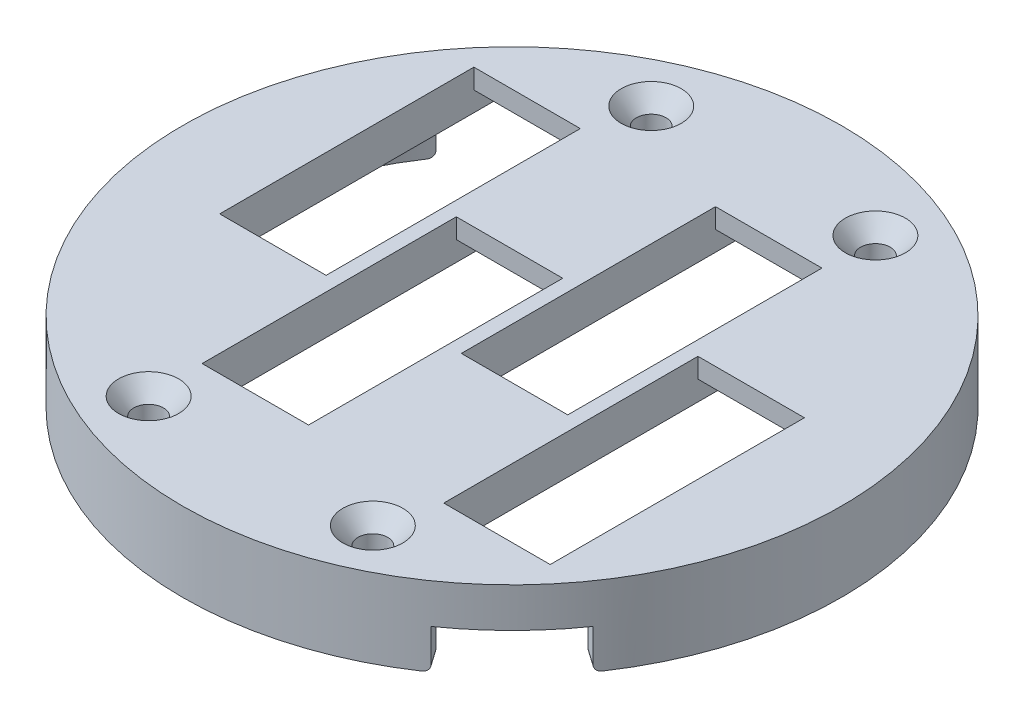
from build123d import *

# Parameters (mm, degrees)
A_BASE_T_START                                    = -1.5
A_BASE_T_OUTLINE_R                                = 47
A_BASE_T_OUTLINE_R_2                              = 1
A_BASE_T_DEPTH                                    = 3
SKETCH2_W                                         = 16.15
SKETCH2_H                                         = 38.570021247
FINGER_BASE_THROUGH_HOLES_DEPTH                   = 67.535704701
RING_START                                        = 3
SKETCH3_R                                         = 4
SKETCH3_R_2                                       = 1
RING_EXTRUDE_DEPTH                                = 3
OUTER_RING_DEPTH                                  = 9
OUTER_RING_DEPTH_BACK                             = 3
SKETCH1_R                                         = 50
SKETCH1_R_2                                       = 47
FRAME_EXTRUDE_1_DEPTH                             = 3
FRAME_START                                       = 3
SKETCH5_W                                         = 16.15
SKETCH5_H                                         = 3
SKETCH5_W_2                                       = 16.149999998
FRAME_EXTRUDE_2_DEPTH                             = 3
CSK_FOR_8_FLAT_HEAD_SOCKET_CAP_SCREW1_D           = 4.4958
CSK_FOR_8_FLAT_HEAD_SOCKET_CAP_SCREW1_CSINK_D     = 9.1186
CSK_FOR_8_FLAT_HEAD_SOCKET_CAP_SCREW1_CSINK_ANGLE = 82
ALLOWANCE_CUT_1_REACH                             = 72.965
ALLOWANCE_CUT_1_DIRECTION_2_REACH                 = 72.965
ALLOWANCE_CUT_2_DEPTH                             = 6
CONTOURING_START                                  = -4.5
CONTOURING_DEPTH                                  = 3.5
CONTOURING_START_2                                = -51
CONTOURING_2_DEPTH                                = 102
CONTOURING_3_DEPTH                                = 102


with BuildPart() as part:
    # a_base_t: read off the stored shape, not the designer's step
    # a_base_t outline → a_base_t (new body)
    with BuildSketch(Plane(origin=(0, 0, 0), x_dir=(1, 0, 0), z_dir=(0, 1, 0)).offset(A_BASE_T_START)):
        Circle(A_BASE_T_OUTLINE_R)
        with Locations((-17.009259258, -38.128042167)):
            Circle(A_BASE_T_OUTLINE_R_2, mode=Mode.SUBTRACT)
        with Locations((-9.166666665, -28.284271247)):
            Circle(A_BASE_T_OUTLINE_R_2, mode=Mode.SUBTRACT)
        with Locations((17.009259258, -38.128042167)):
            Circle(A_BASE_T_OUTLINE_R_2, mode=Mode.SUBTRACT)
        with Locations((27.5, -28.284271247)):
            Circle(A_BASE_T_OUTLINE_R_2, mode=Mode.SUBTRACT)
        with Locations((-27.5, 28.284271247)):
            Circle(A_BASE_T_OUTLINE_R_2, mode=Mode.SUBTRACT)
        with Locations((-17.009259258, 38.128042167)):
            Circle(A_BASE_T_OUTLINE_R_2, mode=Mode.SUBTRACT)
        with Locations((9.166666665, 28.284271247)):
            Circle(A_BASE_T_OUTLINE_R_2, mode=Mode.SUBTRACT)
        with Locations((17.009259258, 38.128042167)):
            Circle(A_BASE_T_OUTLINE_R_2, mode=Mode.SUBTRACT)
    extrude(amount=A_BASE_T_DEPTH)

    # Sketch2 → Finger Base Through Holes (cut, through all)
    with BuildSketch(Plane.XZ.offset(1.5)):
        with Locations((27.499999997, 10.499260624)):
            Rectangle(SKETCH2_W, SKETCH2_H)
        with Locations((9.166666665, -10.499260624)):
            Rectangle(SKETCH2_W, SKETCH2_H)
        with Locations((-9.166666667, 10.499260624)):
            Rectangle(SKETCH2_W, SKETCH2_H)
        with Locations((-27.5, -10.499260624)):
            Rectangle(SKETCH2_W, SKETCH2_H)
    extrude(amount=-FINGER_BASE_THROUGH_HOLES_DEPTH, mode=Mode.SUBTRACT)

    # Sketch3 → Ring Extrude (add)
    # profile 1 of 4: a face of its own
    with BuildSketch(Plane.XZ.offset(1.5).offset(RING_START)):
        with Locations(Location((17.009259258, 38.128042167, 0), (0, 0, 90))):
            Circle(SKETCH3_R)
        with Locations(Location((17.009259258, 38.128042167, 0), (0, 0, 90))):
            Circle(SKETCH3_R_2, mode=Mode.SUBTRACT)
    # profile 2 of 4: a face of its own
    with BuildSketch(Plane.XZ.offset(1.5).offset(RING_START)):
        with Locations(Location((17.009259258, -38.128042167, 0), (0, 0, 90))):
            Circle(SKETCH3_R)
        with Locations(Location((17.009259258, -38.128042167, 0), (0, 0, 270))):
            Circle(SKETCH3_R_2, mode=Mode.SUBTRACT)
    # profile 3 of 4: a face of its own
    with BuildSketch(Plane.XZ.offset(1.5).offset(RING_START)):
        with Locations(Location((-17.009259258, -38.128042167, 0), (0, 0, 90))):
            Circle(SKETCH3_R)
        with Locations(Location((-17.009259258, -38.128042167, 0), (0, 0, 90))):
            Circle(SKETCH3_R_2, mode=Mode.SUBTRACT)
    # profile 4 of 4: a face of its own
    with BuildSketch(Plane.XZ.offset(1.5).offset(RING_START)):
        with Locations(Location((-17.009259258, 38.128042167, 0), (0, 0, 90))):
            Circle(SKETCH3_R)
        with Locations(Location((-17.009259258, 38.128042167, 0), (0, 0, 270))):
            Circle(SKETCH3_R_2, mode=Mode.SUBTRACT)
    extrude(amount=-RING_EXTRUDE_DEPTH)

    # Sketch1 → Outer Ring (add, two sides: drawn at the far end of the back side and taken through both)
    with BuildSketch(Plane.XZ.offset(1.5).offset(-OUTER_RING_DEPTH_BACK)):
        with Locations(Location((0, 0, 0), (0, 0, 90))):
            Circle(SKETCH1_R)
        with Locations(Location((0, 0, 0), (0, 0, 90))):
            Circle(SKETCH1_R_2, mode=Mode.SUBTRACT)
    extrude(amount=OUTER_RING_DEPTH + OUTER_RING_DEPTH_BACK)

    # Sketch4 → Frame Extrude 1 (add)
    with BuildSketch(Plane.XZ.offset(1.5)):
        with BuildLine():
            Line((17.241666665, 34.134799525), (17.241666665, -34.134799525))
            ThreePointArc((17.241666665, -34.134799525), (18.393174805, -34.375072974), (19.424999997, -34.939908437))
            Line((19.424999997, -34.939908437), (19.424999997, 34.939908437))
            ThreePointArc((19.424999997, 34.939908437), (18.393174805, 34.375072974), (17.241666665, 34.134799525))
        make_face()
        with BuildLine():
            Line((1.091666665, 46.987320246), (1.091666665, -46.987320246))
            ThreePointArc((1.091666665, -46.987320246), (-1e-09, -47), (-1.091666667, -46.987320246))
            Line((-1.091666667, -46.987320246), (-1.091666667, 46.987320246))
            ThreePointArc((-1.091666667, 46.987320246), (-1e-09, 47), (1.091666665, 46.987320246))
        make_face()
        with BuildLine():
            Line((35.574999997, 30.715132674), (35.574999997, -30.715132674))
            ThreePointArc((35.574999997, -30.715132674), (37.125311456, -28.82206185), (38.574999997, -26.850872894))
            Line((38.574999997, -26.850872894), (38.574999997, 26.850872894))
            ThreePointArc((38.574999997, 26.850872894), (37.125311456, 28.82206185), (35.574999997, 30.715132674))
        make_face()
        with BuildLine():
            Line((-38.574999997, 26.850872894), (-38.574999997, -26.850872894))
            ThreePointArc((-38.574999997, -26.850872894), (-37.125311456, -28.82206185), (-35.574999997, -30.715132674))
            Line((-35.574999997, -30.715132674), (-35.574999997, 30.715132674))
            ThreePointArc((-35.574999997, 30.715132674), (-37.125311456, 28.82206185), (-38.574999997, 26.850872894))
        make_face()
        with BuildLine():
            Line((-19.424999997, -34.939908437), (-19.424999997, 34.939908437))
            ThreePointArc((-19.424999997, 34.939908437), (-18.393174805, 34.375072974), (-17.241666665, 34.134799525))
            Line((-17.241666665, 34.134799525), (-17.241666665, -34.134799525))
            ThreePointArc((-17.241666665, -34.134799525), (-18.393174805, -34.375072974), (-19.424999997, -34.939908437))
        make_face()
        with BuildLine():
            Line((19.424999997, 41.316175897), (19.424999997, 42.798006672))
            ThreePointArc((19.424999997, 42.798006672), (18.339169616, 43.274413431), (17.241666665, 43.72327676))
            Line((17.241666665, 43.72327676), (17.241666665, 42.121284809))
            ThreePointArc((17.241666665, 42.121284809), (18.393174805, 41.881011359), (19.424999997, 41.316175897))
        make_face()
        with BuildLine():
            Line((19.424999997, -41.316175897), (19.424999997, -42.798006672))
            ThreePointArc((19.424999997, -42.798006672), (18.339169616, -43.274413431), (17.241666665, -43.72327676))
            Line((17.241666665, -43.72327676), (17.241666665, -42.121284809))
            ThreePointArc((17.241666665, -42.121284809), (18.393174805, -41.881011359), (19.424999997, -41.316175897))
        make_face()
        with BuildLine():
            Line((-17.241666665, -42.121284809), (-17.241666665, -43.72327676))
            ThreePointArc((-17.241666665, -43.72327676), (-18.339169616, -43.274413431), (-19.424999997, -42.798006672))
            Line((-19.424999997, -42.798006672), (-19.424999997, -41.316175897))
            ThreePointArc((-19.424999997, -41.316175897), (-18.393174805, -41.881011359), (-17.241666665, -42.121284809))
        make_face()
        with BuildLine():
            Line((-17.241666665, 42.121284809), (-17.241666665, 43.72327676))
            ThreePointArc((-17.241666665, 43.72327676), (-18.339169616, 43.274413431), (-19.424999997, 42.798006672))
            Line((-19.424999997, 42.798006672), (-19.424999997, 41.316175897))
            ThreePointArc((-19.424999997, 41.316175897), (-18.393174805, 41.881011359), (-17.241666665, 42.121284809))
        make_face()
    extrude(amount=FRAME_EXTRUDE_1_DEPTH)

    # Sketch5 → Frame Extrude 2 (add)
    with BuildSketch(Plane.XZ.offset(1.5).offset(FRAME_START)):
        with Locations((27.499999997, -14.28575)):
            Rectangle(SKETCH5_W, SKETCH5_H)
        with Locations((9.166666665, 14.28575)):
            Rectangle(SKETCH5_W, SKETCH5_H)
        with Locations((-9.166666666, -14.28575)):
            Rectangle(SKETCH5_W_2, SKETCH5_H)
        with Locations((-27.499999997, 14.28575)):
            Rectangle(SKETCH5_W, SKETCH5_H)
        with BuildLine():
            Line((17.241666665, -33.784271247), (1.091666665, -33.784271247))
            Line((1.091666665, -33.784271247), (1.091666665, -36.784271247))
            Line((1.091666665, -36.784271247), (13.241729602, -36.784271247))
            ThreePointArc((13.241729602, -36.784271247), (14.800368715, -34.793255432), (17.241666665, -34.134799525))
            Line((17.241666665, -34.134799525), (17.241666665, -33.784271247))
        make_face()
        with BuildLine():
            Line((-19.424999997, -33.784271247), (-32.67450101, -33.784271247))
            ThreePointArc((-32.67450101, -33.784271247), (-26.436742573, -38.859987675), (-19.424999997, -42.798006672))
            Line((-19.424999997, -42.798006672), (-19.424999997, -41.316175897))
            ThreePointArc((-19.424999997, -41.316175897), (-21.009259258, -38.128042167), (-19.424999997, -34.939908437))
            Line((-19.424999997, -34.939908437), (-19.424999997, -33.784271247))
        make_face()
        with BuildLine():
            Line((-1.091666667, 33.784271247), (-17.241666665, 33.784271247))
            Line((-17.241666665, 33.784271247), (-17.241666665, 34.134799525))
            ThreePointArc((-17.241666665, 34.134799525), (-14.800368715, 34.793255432), (-13.241729602, 36.784271247))
            Line((-13.241729602, 36.784271247), (-1.091666667, 36.784271247))
            Line((-1.091666667, 36.784271247), (-1.091666667, 33.784271247))
        make_face()
        with BuildLine():
            Line((19.424999997, 33.784271247), (19.424999997, 34.939908437))
            ThreePointArc((19.424999997, 34.939908437), (21.009259258, 38.128042167), (19.424999997, 41.316175897))
            Line((19.424999997, 41.316175897), (19.424999997, 42.798006672))
            ThreePointArc((19.424999997, 42.798006672), (26.436742573, 38.859987675), (32.67450101, 33.784271247))
            Line((32.67450101, 33.784271247), (19.424999997, 33.784271247))
        make_face()
    extrude(amount=-FRAME_EXTRUDE_2_DEPTH)

    # CSK for #8 Flat Head Socket Cap Screw1 (through all)
    with Locations(Plane(origin=(0, 1.5, 0), x_dir=(1, 0, 0), z_dir=(0, 1, 0))):
        with Locations((-17.009259258, -38.128042167), (-17.009259258, 38.128042167), (17.009259258, 38.128042167), (17.009259258, -38.128042167)):
            CounterSinkHole(CSK_FOR_8_FLAT_HEAD_SOCKET_CAP_SCREW1_D / 2, CSK_FOR_8_FLAT_HEAD_SOCKET_CAP_SCREW1_CSINK_D / 2, counter_sink_angle=CSK_FOR_8_FLAT_HEAD_SOCKET_CAP_SCREW1_CSINK_ANGLE)

    # Allowance Cut 1: up to this face of the body (flat: up to its plane)
    allowance_cut_1_end = Plane(part.part.faces().sort_by_distance((26.989874737, -1.5, 31.713197402))[0])
    # Sketch10 → Allowance Cut 1 (cut, up to the picked face)
    with BuildSketch(Plane.XZ.offset(4.5), mode=Mode.PRIVATE) as allowance_cut_1_sk1:
        Polygon((32.67450101, 33.784271247), (35.574999997, 33.784271247), (35.574999997, 30.715132674), align=None)
    allowance_cut_1_tool1 = split(extrude(allowance_cut_1_sk1.sketch, amount=-ALLOWANCE_CUT_1_REACH, mode=Mode.PRIVATE), bisect_by=allowance_cut_1_end, keep=Keep.BOTH, mode=Mode.PRIVATE)
    # Sketch10 → Allowance Cut 1 (cut, up to the picked face)
    with BuildSketch(Plane.XZ.offset(4.5), mode=Mode.PRIVATE) as allowance_cut_1_sk2:
        Polygon((-35.574999997, -30.715132674), (-35.574999997, -33.784271247), (-32.67450101, -33.784271247), align=None)
    allowance_cut_1_tool2 = split(extrude(allowance_cut_1_sk2.sketch, amount=-ALLOWANCE_CUT_1_REACH, mode=Mode.PRIVATE), bisect_by=allowance_cut_1_end, keep=Keep.BOTH, mode=Mode.PRIVATE)
    add(allowance_cut_1_tool1.solids().sort_by(Axis((34.608167, -4.5, 32.761225), (0, 1, 0)))[0], mode=Mode.SUBTRACT)
    add(allowance_cut_1_tool2.solids().sort_by(Axis((-34.608167, -4.5, -32.761225), (0, 1, 0)))[0], mode=Mode.SUBTRACT)

    # Allowance Cut 1 direction 2: up to this face of the body (flat: up to its plane)
    allowance_cut_1_direction_2_end = Plane(part.part.faces().sort_by_distance((0, -10.5, -48.585786438))[0])
    # Sketch10 → Allowance Cut 1 direction 2 (cut, up to the picked face)
    with BuildSketch(Plane.XZ.offset(4.5), mode=Mode.PRIVATE) as allowance_cut_1_direction_2_sk1:
        Polygon((32.67450101, 33.784271247), (35.574999997, 33.784271247), (35.574999997, 30.715132674), align=None)
    allowance_cut_1_direction_2_tool1 = split(extrude(allowance_cut_1_direction_2_sk1.sketch, amount=ALLOWANCE_CUT_1_DIRECTION_2_REACH, mode=Mode.PRIVATE), bisect_by=allowance_cut_1_direction_2_end, keep=Keep.BOTH, mode=Mode.PRIVATE)
    # Sketch10 → Allowance Cut 1 direction 2 (cut, up to the picked face)
    with BuildSketch(Plane.XZ.offset(4.5), mode=Mode.PRIVATE) as allowance_cut_1_direction_2_sk2:
        Polygon((-35.574999997, -30.715132674), (-35.574999997, -33.784271247), (-32.67450101, -33.784271247), align=None)
    allowance_cut_1_direction_2_tool2 = split(extrude(allowance_cut_1_direction_2_sk2.sketch, amount=ALLOWANCE_CUT_1_DIRECTION_2_REACH, mode=Mode.PRIVATE), bisect_by=allowance_cut_1_direction_2_end, keep=Keep.BOTH, mode=Mode.PRIVATE)
    add(allowance_cut_1_direction_2_tool1.solids().sort_by(Axis((34.608167, -4.5, 32.761225), (0, -1, 0)))[0], mode=Mode.SUBTRACT)
    add(allowance_cut_1_direction_2_tool2.solids().sort_by(Axis((-34.608167, -4.5, -32.761225), (0, -1, 0)))[0], mode=Mode.SUBTRACT)

    # Sketch12 → Allowance Cut 2 (cut)
    with BuildSketch(Plane.XZ.offset(10.5)):
        with BuildLine():
            Line((28.678821818, 40.957602214), (26.958092508, 38.500146082))
            Line((26.958092508, 38.500146082), (38.500146082, 26.958092508))
            Line((38.500146082, 26.958092508), (40.957602214, 28.678821818))
            ThreePointArc((40.957602214, 28.678821818), (35.355339059, 35.355339059), (28.678821818, 40.957602214))
        make_face()
        with BuildLine():
            Line((-26.958092508, -38.500146082), (-28.678821818, -40.957602214))
            ThreePointArc((-28.678821818, -40.957602214), (-35.355339059, -35.355339059), (-40.957602214, -28.678821818))
            Line((-40.957602214, -28.678821818), (-38.500146082, -26.958092508))
            Line((-38.500146082, -26.958092508), (-26.958092508, -38.500146082))
        make_face()
    extrude(amount=-ALLOWANCE_CUT_2_DEPTH, mode=Mode.SUBTRACT)

    # Contouring: read off the stored shape, not the designer's step
    # Contouring outline → Contouring (add)
    with BuildSketch(Plane(origin=(0, 0, 0), x_dir=(1, 0, 0), z_dir=(0, 1, 0)).offset(CONTOURING_START)):
        with BuildLine():
            Line((17.241666665, -15.78575), (16.241666665, -15.78575))
            ThreePointArc((16.241666665, -15.78575), (16.948773446, -16.078643219), (17.241666665, -16.78575))
            Line((17.241666665, -16.78575), (17.241666665, -15.78575))
        make_face()
        with BuildLine():
            ThreePointArc((17.241666665, -43.037289226), (17.064187093, -43.606024793), (16.594746375, -43.97288247))
            ThreePointArc((16.594746375, -43.97288247), (16.918666839, -43.849272655), (17.241666665, -43.72327676))
            Line((17.241666665, -43.72327676), (17.241666665, -43.037289226))
        make_face()
        with BuildLine():
            ThreePointArc((-40.435326085, -23.957971626), (-39.531634502, -25.421445153), (-38.574999998, -26.850872894))
            Line((-38.574999998, -26.850872894), (-38.574999998, -23.448227549))
            ThreePointArc((-38.574999998, -23.448227549), (-39.310733169, -24.412677156), (-40.435326085, -23.957971626))
        make_face()
        with BuildLine():
            Line((-19.424999997, -15.78575), (-20.425, -15.78575))
            ThreePointArc((-20.425, -15.78575), (-19.717893219, -16.078643219), (-19.425, -16.78575))
            Line((-19.425, -16.78575), (-19.424999997, -15.78575))
        make_face()
        with BuildLine():
            Line((-35.575, -15.78575), (-35.575, -16.78575))
            ThreePointArc((-35.575, -16.78575), (-35.282106781, -16.078643219), (-34.575, -15.78575))
            Line((-34.575, -15.78575), (-35.575, -15.78575))
        make_face()
        with BuildLine():
            ThreePointArc((-35.574999999, -30.715132673), (-35.451102296, -30.858051559), (-35.326630435, -31.000470676))
            ThreePointArc((-35.326630435, -31.000470676), (-35.510849997, -30.693284806), (-35.575, -30.340886193))
            Line((-35.575, -30.340886193), (-35.574999999, -30.715132673))
        make_face()
        with BuildLine():
            ThreePointArc((-20.864193833, -42.115144731), (-20.147490166, -42.462673491), (-19.424999997, -42.798006672))
            Line((-19.424999997, -42.798006672), (-19.424999998, -41.316175897))
            ThreePointArc((-19.424999998, -41.316175897), (-19.934902686, -42.093385488), (-20.864193833, -42.115144731))
        make_face()
        with BuildLine():
            ThreePointArc((-17.241666665, -43.72327676), (-16.918666839, -43.849272655), (-16.594746375, -43.97288247))
            ThreePointArc((-16.594746375, -43.97288247), (-17.064187093, -43.606024793), (-17.241666665, -43.037289226))
            Line((-17.241666665, -43.037289226), (-17.241666665, -43.72327676))
        make_face()
        with BuildLine():
            ThreePointArc((-2.091666667, -36.784271247), (-1.384559886, -37.077164466), (-1.091666667, -37.784271247))
            Line((-1.091666667, -37.784271247), (-1.091666667, -36.784271247))
            Line((-1.091666667, -36.784271247), (-2.091666667, -36.784271247))
        make_face()
        with BuildLine():
            ThreePointArc((-2.137137682, -46.951385949), (-1.614502152, -46.972261845), (-1.091666667, -46.987320246))
            Line((-1.091666667, -46.987320246), (-1.091666667, -45.95242029))
            ThreePointArc((-1.091666667, -45.95242029), (-1.400823347, -46.67542479), (-2.137137682, -46.951385949))
        make_face()
        with BuildLine():
            ThreePointArc((2.137137679, -46.951385949), (1.400823345, -46.675424791), (1.091666665, -45.952420291))
            Line((1.091666665, -45.952420291), (1.091666665, -46.987320246))
            ThreePointArc((1.091666665, -46.987320246), (1.61450215, -46.972261845), (2.137137679, -46.951385949))
        make_face()
        with BuildLine():
            ThreePointArc((1.091666665, -16.78575), (1.384559884, -16.078643219), (2.091666665, -15.78575))
            Line((2.091666665, -15.78575), (1.091666665, -15.78575))
            Line((1.091666665, -15.78575), (1.091666665, -16.78575))
        make_face()
        with BuildLine():
            ThreePointArc((-38.574999998, 26.850872894), (-39.531634502, 25.421445153), (-40.435326085, 23.957971627))
            ThreePointArc((-40.435326085, 23.957971627), (-39.310733169, 24.412677156), (-38.574999998, 23.448227549))
            Line((-38.574999998, 23.448227549), (-38.574999998, 26.850872894))
        make_face()
        with BuildLine():
            Line((19.424999997, 15.78575), (20.424999997, 15.78575))
            ThreePointArc((20.424999997, 15.78575), (19.717893216, 16.078643219), (19.424999997, 16.78575))
            Line((19.424999997, 16.78575), (19.424999997, 15.78575))
        make_face()
        with BuildLine():
            Line((35.574999997, 15.78575), (35.574999997, 16.78575))
            ThreePointArc((35.574999997, 16.78575), (35.282106779, 16.078643218), (34.574999997, 15.78575))
            Line((34.574999997, 15.78575), (35.574999997, 15.78575))
        make_face()
        with BuildLine():
            ThreePointArc((2.091666665, 36.784271247), (1.384559884, 37.077164466), (1.091666665, 37.784271247))
            Line((1.091666665, 37.784271247), (1.091666665, 36.784271247))
            Line((1.091666665, 36.784271247), (2.091666665, 36.784271247))
        make_face()
        with BuildLine():
            Line((-17.241666665, 15.78575), (-16.241666667, 15.78575))
            ThreePointArc((-16.241666667, 15.78575), (-16.948773449, 16.078643219), (-17.241666667, 16.78575))
            Line((-17.241666667, 16.78575), (-17.241666665, 15.78575))
        make_face()
        with BuildLine():
            Line((-1.091666667, 15.78575), (-1.091666667, 16.78575))
            ThreePointArc((-1.091666667, 16.78575), (-1.384559886, 16.078643219), (-2.091666667, 15.78575))
            Line((-2.091666667, 15.78575), (-1.091666667, 15.78575))
        make_face()
        with BuildLine():
            ThreePointArc((-17.241666665, 43.037289226), (-17.064187093, 43.606024793), (-16.594746375, 43.97288247))
            ThreePointArc((-16.594746375, 43.97288247), (-16.918666839, 43.849272655), (-17.241666665, 43.72327676))
            Line((-17.241666665, 43.72327676), (-17.241666665, 43.037289226))
        make_face()
        with BuildLine():
            Line((-1.091666667, 45.95242029), (-1.091666667, 46.987320246))
            ThreePointArc((-1.091666667, 46.987320246), (-1.614502152, 46.972261845), (-2.137137682, 46.951385949))
            ThreePointArc((-2.137137682, 46.951385949), (-1.400823347, 46.67542479), (-1.091666667, 45.95242029))
        make_face()
        with BuildLine():
            ThreePointArc((1.091666665, 45.952420291), (1.400823345, 46.675424791), (2.137137679, 46.951385949))
            ThreePointArc((2.137137679, 46.951385949), (1.61450215, 46.972261845), (1.091666665, 46.987320246))
            Line((1.091666665, 46.987320246), (1.091666665, 45.952420291))
        make_face()
        with BuildLine():
            Line((17.241666665, 43.037289226), (17.241666665, 43.72327676))
            ThreePointArc((17.241666665, 43.72327676), (16.918666839, 43.849272655), (16.594746375, 43.97288247))
            ThreePointArc((16.594746375, 43.97288247), (17.064187093, 43.606024793), (17.241666665, 43.037289226))
        make_face()
        with BuildLine():
            ThreePointArc((19.424999997, 41.316175897), (19.934902686, 42.093385488), (20.864193833, 42.115144731))
            ThreePointArc((20.864193833, 42.115144731), (20.147490166, 42.462673491), (19.424999997, 42.798006672))
            Line((19.424999997, 42.798006672), (19.424999997, 41.316175897))
        make_face()
        with BuildLine():
            Line((35.574999998, 30.340886196), (35.574999998, 30.715132674))
            ThreePointArc((35.574999998, 30.715132674), (35.451102294, 30.858051562), (35.326630432, 31.000470679))
            ThreePointArc((35.326630432, 31.000470679), (35.510849995, 30.69328481), (35.574999998, 30.340886196))
        make_face()
        with BuildLine():
            ThreePointArc((40.435326084, -23.957971626), (39.310733169, -24.412677156), (38.574999998, -23.448227549))
            Line((38.574999998, -23.448227549), (38.574999998, -26.850872894))
            ThreePointArc((38.574999998, -26.850872894), (39.531634502, -25.421445153), (40.435326084, -23.957971626))
        make_face()
        with BuildLine():
            Line((38.574999998, 26.850872894), (38.574999998, 23.448227549))
            ThreePointArc((38.574999998, 23.448227549), (39.310733169, 24.412677156), (40.435326084, 23.957971626))
            ThreePointArc((40.435326084, 23.957971626), (39.531634502, 25.421445153), (38.574999998, 26.850872894))
        make_face()
    extrude(amount=CONTOURING_DEPTH)

    # Contouring 2 outline → Contouring 2 (cut)
    with BuildSketch(Plane(origin=(0, 0, 0), x_dir=(0.5735764363510298, 0, -0.8191520442890032), z_dir=(0.8191520442890031, 0, 0.5735764363510301)).offset(CONTOURING_START_2)):
        with BuildLine():
            ThreePointArc((1, -10.5), (0.292893219, -10.207106781), (0, -9.5))
            ThreePointArc((0, -9.5), (-0.292893219, -10.207106781), (-1, -10.5))
            Line((-1, -10.5), (1, -10.5))
        make_face()
    extrude(amount=CONTOURING_2_DEPTH, mode=Mode.SUBTRACT)

    # Contouring 3 outline → Contouring 3 (cut)
    with BuildSketch(Plane(origin=(0, 0, 0), x_dir=(0.8191520442889688, 0, -0.5735764363510789), z_dir=(0.5735764363510789, 0, 0.8191520442889688)).offset(CONTOURING_START_2)):
        with BuildLine():
            ThreePointArc((0, -9.5), (-0.292893219, -10.207106781), (-1, -10.5))
            Line((-1, -10.5), (1, -10.5))
            ThreePointArc((1, -10.5), (0.292893219, -10.207106781), (0, -9.5))
        make_face()
    extrude(amount=CONTOURING_3_DEPTH, mode=Mode.SUBTRACT)


solid = part.part
